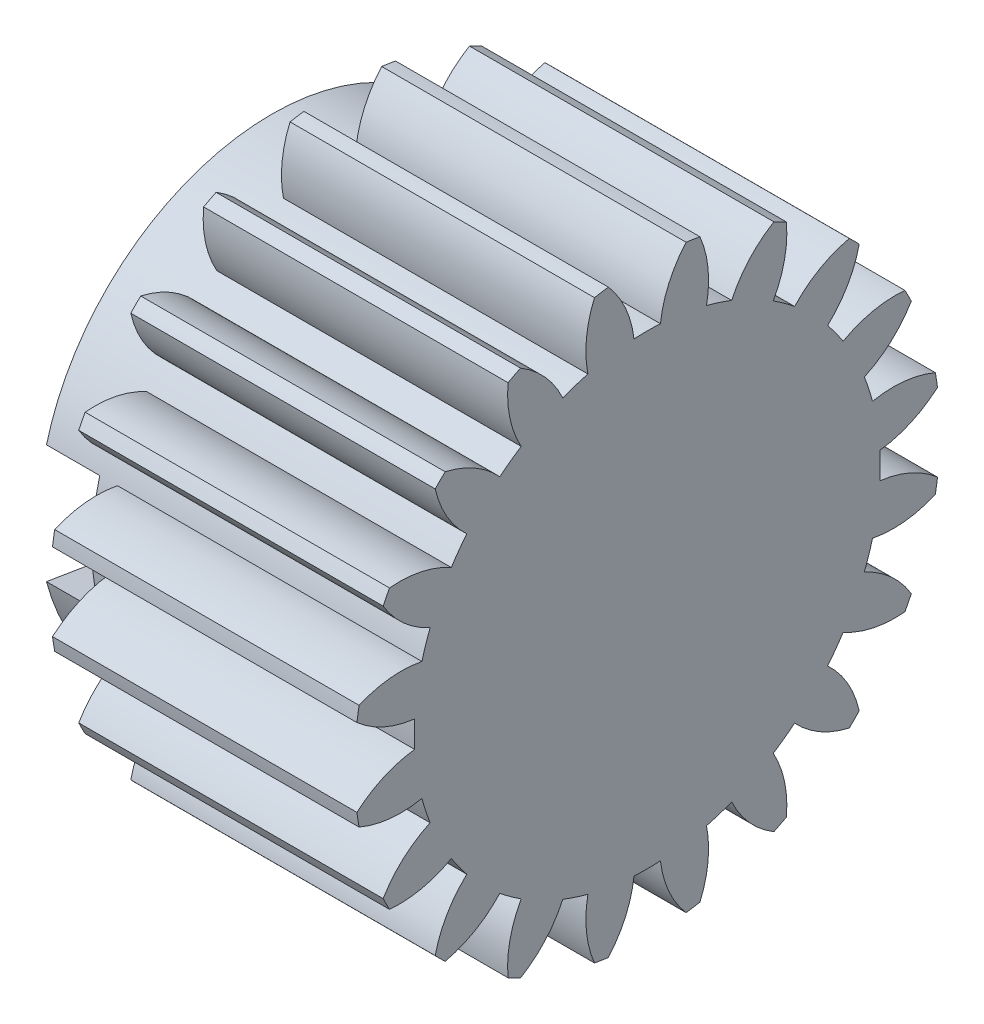
from build123d import *
from build123d.topology import SkipClean

# Parameters (mm, degrees)
BASPROSKE_W         = 10
BASPROSKE_H         = 16.5
TOOTHCUT_DEPTH      = 26.38700455
TEETHCUTS_COUNT     = 20
TEETHCUTS_ANGLE     = 342
HUBNEARONE_START    = 6.0000508
HUBNEAONESKE_R      = 13.124
HUBNEARONE_DEPTH    = 6.0000508
BORSKE_R            = 0.4
BORE_DEPTH          = 16.0000508
CUT_EXTRUDE1_DEPTH  = 5
BOSS_EXTRUDE1_DEPTH = 7.15
SKETCH4_R           = 13.124
CUT_EXTRUDE2_DEPTH  = 2


with BuildPart() as part:
    # BasProSke → Base-Revolve (revolve)
    with BuildSketch(Plane(origin=(0, 0, 0), x_dir=(1, 0, 0), z_dir=(0, 1, 0))):
        with Locations((5, 8.25)):
            Rectangle(BASPROSKE_W, BASPROSKE_H)
    revolve(axis=Axis((-10, 0, 0), (1, 0, 0)))

    # TooCutSke → ToothCut (cut, through all)
    with BuildSketch(Plane(origin=(0, 0, 0), x_dir=(0, 0, -1), z_dir=(1, 0, 0))):
        with BuildLine():
            ThreePointArc((0.74381438, 13.102904875), (0, 13.124), (-0.74381438, 13.102904875))
            ThreePointArc((-0.74381438, 13.102904875), (-1.226473103, 14.852072512), (-2.209965745, 16.376962373))
            ThreePointArc((-2.209965745, 16.376962373), (0, 16.5254), (2.209965745, 16.376962373))
            ThreePointArc((2.209965745, 16.376962373), (1.226473103, 14.852072512), (0.74381438, 13.102904875))
        make_face()
    toothcut = extrude(amount=TOOTHCUT_DEPTH, mode=Mode.SUBTRACT)

    # TeethCuts: ToothCut ×20 about axis
    teethcuts_axis = Axis((-10, 0, 0), (1, 0, 0))
    for i in range(1, TEETHCUTS_COUNT):
        add(toothcut.rotate(teethcuts_axis, i * TEETHCUTS_ANGLE / (TEETHCUTS_COUNT - 1)), mode=Mode.SUBTRACT)

    # HubNeaOneSke → HubNearOne (add)
    with SkipClean():  # the faces are left unmerged after this step: merging them gives an invalid solid
        with BuildSketch(Plane.ZY.offset(HUBNEARONE_START)):
            Circle(HUBNEAONESKE_R)
        extrude(amount=-HUBNEARONE_DEPTH)

    # BorSke → Bore (cut, symmetric)
    with SkipClean():  # the faces are left unmerged after this step: merging them gives an invalid solid
        with BuildSketch(Plane(origin=(0, 0, 0), x_dir=(0, 0, -1), z_dir=(1, 0, 0))):
            Circle(BORSKE_R)
        extrude(amount=BORE_DEPTH, both=True, mode=Mode.SUBTRACT)

    # Sketch1 → Cut-Extrude1 (cut)
    with SkipClean():  # the faces are left unmerged after this step: merging them gives an invalid solid
        with BuildSketch(Plane.ZY.offset(6.0000508)):
            with BuildLine():
                Line((15.95, 2.8), (4.417295553, 4.7))
                ThreePointArc((4.417295553, 4.7), (0, 6.45), (-4.417295553, 4.7))
                Line((-4.417295553, 4.7), (-15.95, 2.8))
                ThreePointArc((-15.95, 2.8), (-18.75, 0), (-15.95, -2.8))
                Line((-15.95, -2.8), (-4.417295553, -4.7))
                ThreePointArc((-4.417295553, -4.7), (0, -6.45), (4.417295553, -4.7))
                Line((4.417295553, -4.7), (15.95, -2.8))
                ThreePointArc((15.95, -2.8), (18.75, 0), (15.95, 2.8))
            make_face()
        extrude(amount=-CUT_EXTRUDE1_DEPTH, mode=Mode.SUBTRACT)

    # Sketch2 → Boss-Extrude1 (add)
    with SkipClean():  # the faces are left unmerged after this step: merging them gives an invalid solid
        with BuildSketch(Plane(origin=(10, 0, 0), x_dir=(0, 0, -1), z_dir=(1, 0, 0))):
            with BuildLine():
                ThreePointArc((-16.354046896, 2.189783121), (-14.838129876, 1.220250755), (-13.102904875, 0.74381438))
                ThreePointArc((-13.102904875, 0.74381438), (-13.124, 0), (-13.102904875, -0.74381438))
                ThreePointArc((-13.102904875, -0.74381438), (-14.838129876, -1.220250755), (-16.354046896, -2.189783121))
                ThreePointArc((-16.354046896, -2.189783121), (-16.29685762, -2.581168673), (-16.230303067, -2.971070911))
                ThreePointArc((-16.230303067, -2.971070911), (-14.488978329, -3.424706864), (-12.691454348, -3.341610769))
                ThreePointArc((-12.691454348, -3.341610769), (-12.48166572, -4.055539034), (-12.23175178, -4.756429795))
                ThreePointArc((-12.23175178, -4.756429795), (-13.734821887, -5.745761728), (-14.87694267, -7.136285925))
                ThreePointArc((-14.87694267, -7.136285925), (-14.701607649, -7.490843246), (-14.51782409, -7.841095822))
                ThreePointArc((-14.51782409, -7.841095822), (-12.721544632, -7.734430314), (-11.037675843, -7.099935773))
                ThreePointArc((-11.037675843, -7.099935773), (-10.617539034, -7.714093651), (-10.163269596, -8.303452722))
                ThreePointArc((-10.163269596, -8.303452722), (-11.287053836, -9.708837511), (-11.943579641, -11.38423934))
                ThreePointArc((-11.943579641, -11.38423934), (-11.66726189, -11.66726189), (-11.38423934, -11.943579641))
                ThreePointArc((-11.38423934, -11.943579641), (-9.708837511, -11.287053836), (-8.303452722, -10.163269596))
                ThreePointArc((-8.303452722, -10.163269596), (-7.714093651, -10.617539034), (-7.099935773, -11.037675843))
                ThreePointArc((-7.099935773, -11.037675843), (-7.734430314, -12.721544632), (-7.841095822, -14.51782409))
                ThreePointArc((-7.841095822, -14.51782409), (-7.490843246, -14.701607649), (-7.136285925, -14.87694267))
                ThreePointArc((-7.136285925, -14.87694267), (-5.745761728, -13.734821887), (-4.756429795, -12.23175178))
                ThreePointArc((-4.756429795, -12.23175178), (-4.055539034, -12.48166572), (-3.341610769, -12.691454348))
                ThreePointArc((-3.341610769, -12.691454348), (-3.424706864, -14.488978329), (-2.971070911, -16.230303067))
                ThreePointArc((-2.971070911, -16.230303067), (-2.581168673, -16.29685762), (-2.189783121, -16.354046896))
                ThreePointArc((-2.189783121, -16.354046896), (-1.220250755, -14.838129876), (-0.74381438, -13.102904875))
                ThreePointArc((-0.74381438, -13.102904875), (0, -13.124), (0.74381438, -13.102904875))
                ThreePointArc((0.74381438, -13.102904875), (1.220250755, -14.838129876), (2.189783121, -16.354046896))
                ThreePointArc((2.189783121, -16.354046896), (2.581168673, -16.29685762), (2.971070911, -16.230303067))
                ThreePointArc((2.971070911, -16.230303067), (3.424706864, -14.488978329), (3.341610769, -12.691454348))
                ThreePointArc((3.341610769, -12.691454348), (4.055539034, -12.48166572), (4.756429795, -12.23175178))
                ThreePointArc((4.756429795, -12.23175178), (5.745761728, -13.734821887), (7.136285925, -14.87694267))
                ThreePointArc((7.136285925, -14.87694267), (7.490843246, -14.701607649), (7.841095822, -14.51782409))
                ThreePointArc((7.841095822, -14.51782409), (7.734430314, -12.721544632), (7.099935773, -11.037675843))
                ThreePointArc((7.099935773, -11.037675843), (7.714093651, -10.617539034), (8.303452722, -10.163269596))
                ThreePointArc((8.303452722, -10.163269596), (9.708837511, -11.287053836), (11.38423934, -11.943579641))
                ThreePointArc((11.38423934, -11.943579641), (11.66726189, -11.66726189), (11.943579641, -11.38423934))
                ThreePointArc((11.943579641, -11.38423934), (11.287053836, -9.708837511), (10.163269596, -8.303452722))
                ThreePointArc((10.163269596, -8.303452722), (10.617539034, -7.714093651), (11.037675843, -7.099935773))
                ThreePointArc((11.037675843, -7.099935773), (12.721544632, -7.734430314), (14.51782409, -7.841095822))
                ThreePointArc((14.51782409, -7.841095822), (14.701607649, -7.490843246), (14.87694267, -7.136285925))
                ThreePointArc((14.87694267, -7.136285925), (13.734821887, -5.745761728), (12.23175178, -4.756429795))
                ThreePointArc((12.23175178, -4.756429795), (12.48166572, -4.055539034), (12.691454348, -3.341610769))
                ThreePointArc((12.691454348, -3.341610769), (14.488978329, -3.424706864), (16.230303067, -2.971070911))
                ThreePointArc((16.230303067, -2.971070911), (16.29685762, -2.581168673), (16.354046896, -2.189783121))
                ThreePointArc((16.354046896, -2.189783121), (14.838129876, -1.220250755), (13.102904875, -0.74381438))
                ThreePointArc((13.102904875, -0.74381438), (13.124, 0), (13.102904875, 0.74381438))
                ThreePointArc((13.102904875, 0.74381438), (14.838129876, 1.220250755), (16.354046896, 2.189783121))
                ThreePointArc((16.354046896, 2.189783121), (16.29685762, 2.581168673), (16.230303067, 2.971070911))
                ThreePointArc((16.230303067, 2.971070911), (14.488978329, 3.424706864), (12.691454348, 3.341610769))
                ThreePointArc((12.691454348, 3.341610769), (12.48166572, 4.055539034), (12.23175178, 4.756429795))
                ThreePointArc((12.23175178, 4.756429795), (13.734821887, 5.745761728), (14.87694267, 7.136285925))
                ThreePointArc((14.87694267, 7.136285925), (14.701607649, 7.490843246), (14.51782409, 7.841095822))
                ThreePointArc((14.51782409, 7.841095822), (12.721544632, 7.734430314), (11.037675843, 7.099935773))
                ThreePointArc((11.037675843, 7.099935773), (10.617539034, 7.714093651), (10.163269596, 8.303452722))
                ThreePointArc((10.163269596, 8.303452722), (11.287053836, 9.708837511), (11.943579641, 11.38423934))
                ThreePointArc((11.943579641, 11.38423934), (11.66726189, 11.66726189), (11.38423934, 11.943579641))
                ThreePointArc((11.38423934, 11.943579641), (9.708837511, 11.287053836), (8.303452722, 10.163269596))
                ThreePointArc((8.303452722, 10.163269596), (7.714093651, 10.617539034), (7.099935773, 11.037675843))
                ThreePointArc((7.099935773, 11.037675843), (7.734430314, 12.721544632), (7.841095822, 14.51782409))
                ThreePointArc((7.841095822, 14.51782409), (7.490843246, 14.701607649), (7.136285925, 14.87694267))
                ThreePointArc((7.136285925, 14.87694267), (5.745761728, 13.734821887), (4.756429795, 12.23175178))
                ThreePointArc((4.756429795, 12.23175178), (4.055539034, 12.48166572), (3.341610769, 12.691454348))
                ThreePointArc((3.341610769, 12.691454348), (3.424706864, 14.488978329), (2.971070911, 16.230303067))
                ThreePointArc((2.971070911, 16.230303067), (2.581168673, 16.29685762), (2.189783121, 16.354046896))
                ThreePointArc((2.189783121, 16.354046896), (1.220250755, 14.838129876), (0.74381438, 13.102904875))
                ThreePointArc((0.74381438, 13.102904875), (0, 13.124), (-0.74381438, 13.102904875))
                ThreePointArc((-0.74381438, 13.102904875), (-1.220250755, 14.838129876), (-2.189783121, 16.354046896))
                ThreePointArc((-2.189783121, 16.354046896), (-2.581168673, 16.29685762), (-2.971070911, 16.230303067))
                ThreePointArc((-2.971070911, 16.230303067), (-3.424706864, 14.488978329), (-3.341610769, 12.691454348))
                ThreePointArc((-3.341610769, 12.691454348), (-4.055539034, 12.48166572), (-4.756429795, 12.23175178))
                ThreePointArc((-4.756429795, 12.23175178), (-5.745761728, 13.734821887), (-7.136285925, 14.87694267))
                ThreePointArc((-7.136285925, 14.87694267), (-7.490843246, 14.701607649), (-7.841095822, 14.51782409))
                ThreePointArc((-7.841095822, 14.51782409), (-7.734430314, 12.721544632), (-7.099935773, 11.037675843))
                ThreePointArc((-7.099935773, 11.037675843), (-7.714093651, 10.617539034), (-8.303452722, 10.163269596))
                ThreePointArc((-8.303452722, 10.163269596), (-9.708837511, 11.287053836), (-11.38423934, 11.943579641))
                ThreePointArc((-11.38423934, 11.943579641), (-11.66726189, 11.66726189), (-11.943579641, 11.38423934))
                ThreePointArc((-11.943579641, 11.38423934), (-11.287053836, 9.708837511), (-10.163269596, 8.303452722))
                ThreePointArc((-10.163269596, 8.303452722), (-10.617539034, 7.714093651), (-11.037675843, 7.099935773))
                ThreePointArc((-11.037675843, 7.099935773), (-12.721544632, 7.734430314), (-14.51782409, 7.841095822))
                ThreePointArc((-14.51782409, 7.841095822), (-14.701607649, 7.490843246), (-14.87694267, 7.136285925))
                ThreePointArc((-14.87694267, 7.136285925), (-13.734821887, 5.745761728), (-12.23175178, 4.756429795))
                ThreePointArc((-12.23175178, 4.756429795), (-12.48166572, 4.055539034), (-12.691454348, 3.341610769))
                ThreePointArc((-12.691454348, 3.341610769), (-14.488978329, 3.424706864), (-16.230303067, 2.971070911))
                ThreePointArc((-16.230303067, 2.971070911), (-16.29685762, 2.581168673), (-16.354046896, 2.189783121))
            make_face()
        extrude(amount=BOSS_EXTRUDE1_DEPTH)

    # Sketch4 → Cut-Extrude2 (cut)
    with SkipClean():  # the faces are left unmerged after this step: merging them gives an invalid solid
        with BuildSketch(Plane.ZY.offset(6.0000508)):
            Circle(SKETCH4_R)
        extrude(amount=-CUT_EXTRUDE2_DEPTH, mode=Mode.SUBTRACT)


solid = part.part
